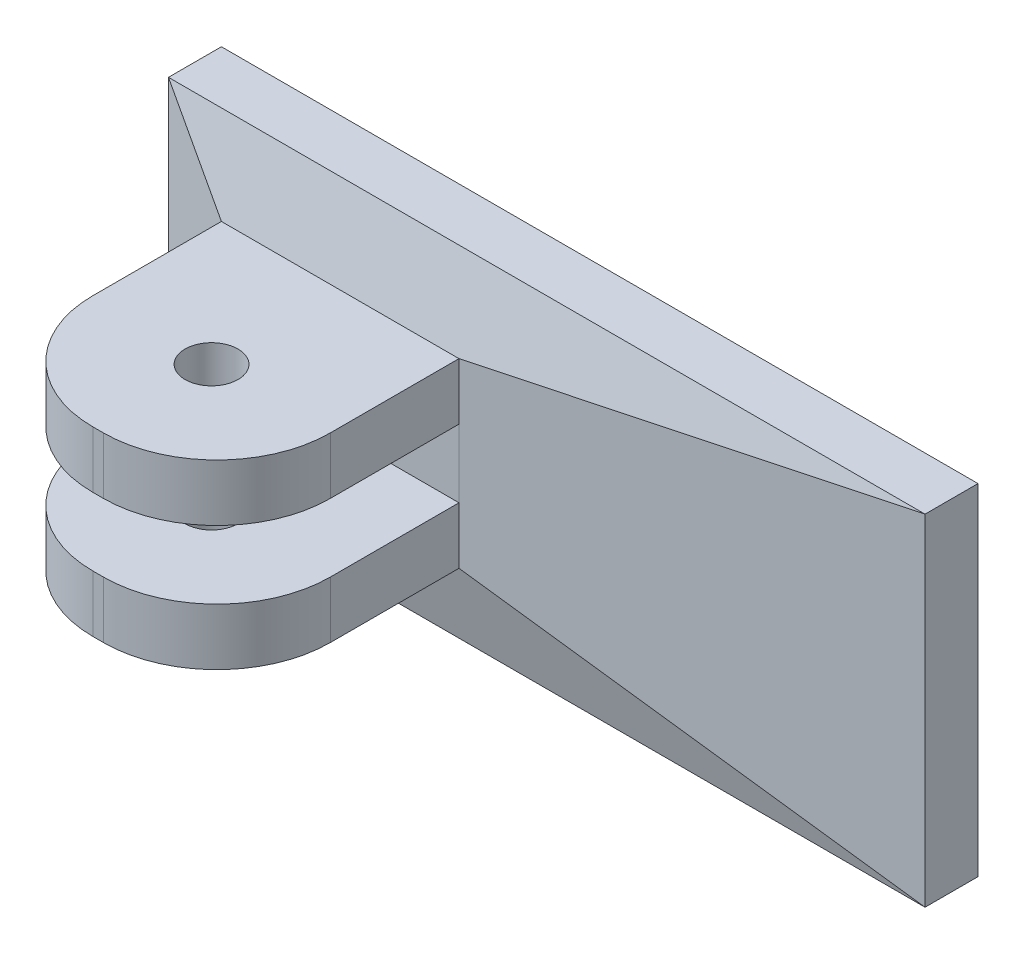
from build123d import *

# Parameters (mm, degrees)
SKETCH1_W           = 100
SKETCH1_H           = 45
BOSS_EXTRUDE1_DEPTH = 10
SKETCH3_W           = 31.4
SKETCH3_H           = 7.5
BOSS_EXTRUDE2_DEPTH = 5
SKETCH4_R           = 3.5
BOSS_EXTRUDE3_DEPTH = 7.5
CUT_EXTRUDE1_DEPTH  = 45
CUT_EXTRUDE2_DEPTH  = 100


with BuildPart() as part:
    # Sketch1 → Boss-Extrude1 (new body)
    with BuildSketch(Plane.XY):
        with Locations((26.050004349, -7.647768163)):
            Rectangle(SKETCH1_W, SKETCH1_H)
    extrude(amount=BOSS_EXTRUDE1_DEPTH)

    # Sketch3 → Boss-Extrude2 (add)
    with BuildSketch(Plane.XY.offset(10)):
        with Locations((1.750004349, 1.102231837)):
            Rectangle(SKETCH3_W, SKETCH3_H)
    boss_extrude2 = extrude(amount=BOSS_EXTRUDE2_DEPTH)

    # Sketch4 → Boss-Extrude3 (add)
    with BuildSketch(Plane.XZ.offset(2.647768163)):
        with BuildLine():
            Line((-13.949995651, 15), (-13.949995651, 27))
            ThreePointArc((-13.949995651, 27), (-9.556597369, 37.606601718), (1.050004349, 42))
            Line((1.050004349, 42), (2.450004349, 42))
            ThreePointArc((2.450004349, 42), (13.056606067, 37.606601718), (17.450004349, 27))
            Line((17.450004349, 27), (17.450004349, 15))
            Line((17.450004349, 15), (-13.949995651, 15))
        make_face()
        with Locations((1.744890168, 27)):
            Circle(SKETCH4_R, mode=Mode.SUBTRACT)
    boss_extrude3 = extrude(amount=-BOSS_EXTRUDE3_DEPTH)

    # Mirror1: Boss-Extrude2, Boss-Extrude3 across plane
    add(boss_extrude2.mirror(Plane(origin=(0, -7.147768163, 0), x_dir=(0, 0, 1), z_dir=(0, -1, 0))))
    add(boss_extrude3.mirror(Plane(origin=(0, -7.147768163, 0), x_dir=(0, 0, 1), z_dir=(0, -1, 0))))

    # Sketch5 → Cut-Extrude1 (cut)
    with BuildSketch(Plane.XZ.offset(30.147768163)):
        Polygon((-13.949995651, 10), (-23.949995651, 7), (-23.949995651, 10), align=None)
        Polygon((17.450004349, 10), (76.050004349, 7), (76.050004349, 10), align=None)
    extrude(amount=-CUT_EXTRUDE1_DEPTH, mode=Mode.SUBTRACT)

    # Sketch6 → Cut-Extrude2 (cut)
    with BuildSketch(Plane.ZY.offset(23.949995651)):
        Polygon((7, 14.852231837), (10, 4.852231837), (10, 14.852231837), align=None)
        Polygon((10, -19.147768163), (7, -30.147768163), (10, -30.147768163), align=None)
    extrude(amount=-CUT_EXTRUDE2_DEPTH, mode=Mode.SUBTRACT)


solid = part.part
